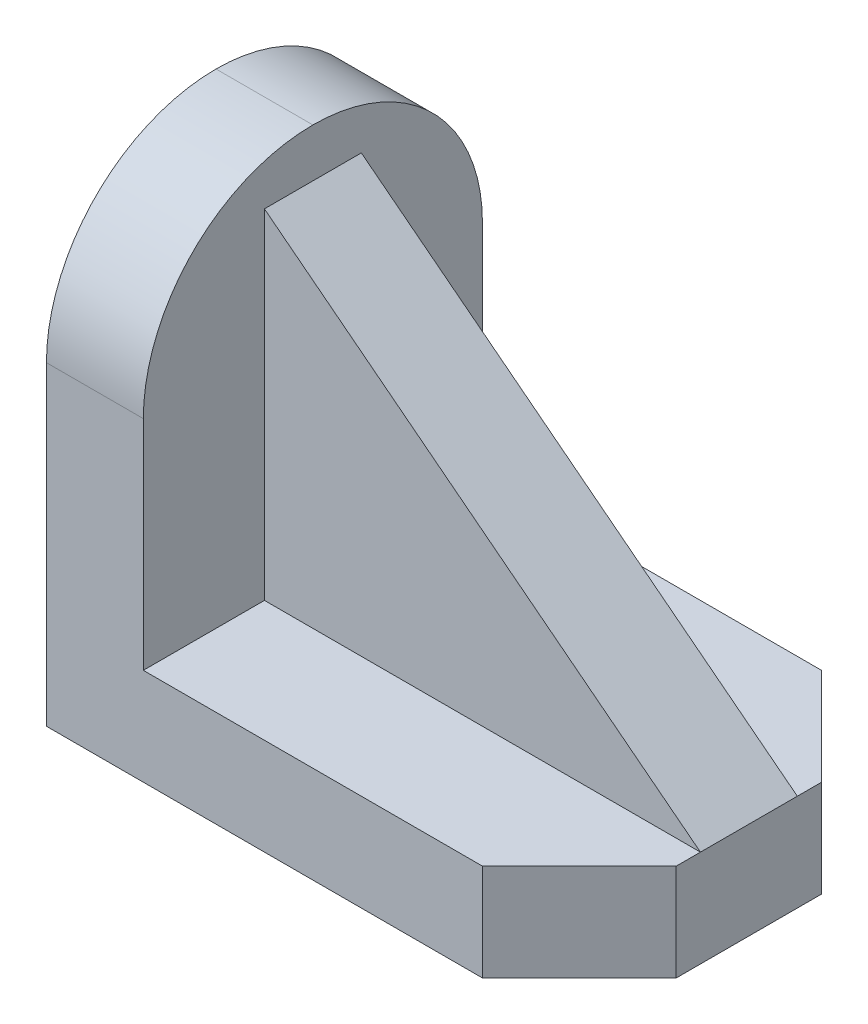
from build123d import *

# Parameters (mm, degrees)
SKETCH3_W           = 66
SKETCH3_H           = 42
BOSS_EXTRUDE1_DEPTH = 12
CHAMFER1_SIZE       = 12
SKETCH4_W           = 12
SKETCH4_H           = 42
BOSS_EXTRUDE2_DEPTH = 48
FILLET1_R           = 21
BOSS_EXTRUDE5_DEPTH = 6


with BuildPart() as part:
    # Sketch3 → Boss-Extrude1 (new body)
    with BuildSketch(Plane(origin=(0, 0, 0), x_dir=(1, 0, 0), z_dir=(0, 1, 0))):
        Rectangle(SKETCH3_W, SKETCH3_H)
    extrude(amount=BOSS_EXTRUDE1_DEPTH)

    # Chamfer1
    chamfer1_edges = [part.edges().sort_by_distance(p)[0] for p in [
        (33, 6, 21),
        (33, 6, -21),
    ]]
    chamfer(chamfer1_edges, length=CHAMFER1_SIZE)

    # Sketch4 → Boss-Extrude2 (add)
    with BuildSketch(Plane(origin=(0, 12, 0), x_dir=(1, 0, 0), z_dir=(0, 1, 0))):
        with Locations((-27, 0)):
            Rectangle(SKETCH4_W, SKETCH4_H)
    extrude(amount=BOSS_EXTRUDE2_DEPTH)

    # Fillet1
    fillet1_edges = [part.edges().sort_by_distance(p)[0] for p in [
        (-27, 60, 21),
        (-27, 60, -21),
    ]]
    fillet(fillet1_edges, radius=FILLET1_R - 0.0001)  # a hair under: the kernel refuses the full size

    # Sketch6 → Boss-Extrude5 (add, symmetric)
    with BuildSketch(Plane.XY):
        Polygon((-21, 54), (33, 12), (-21, 12), align=None)
    extrude(amount=BOSS_EXTRUDE5_DEPTH, both=True)


solid = part.part
